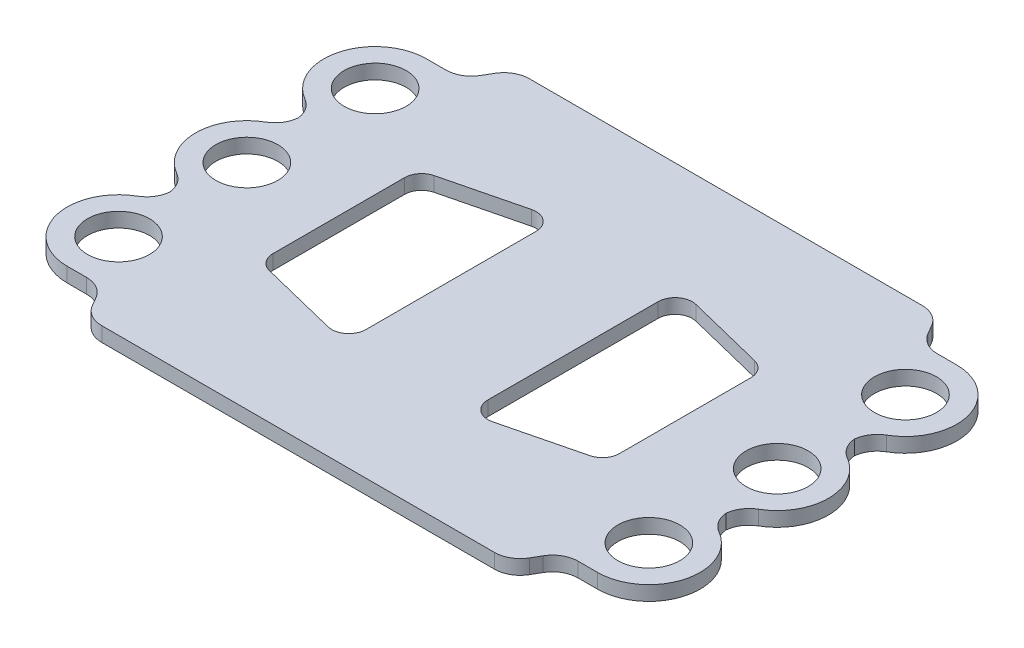
from build123d import *

# Parameters (mm, degrees)
SKETCH1_R           = 6
SKETCH1_R_2         = 3.625
BOSS_EXTRUDE1_DEPTH = 1.7
CUT_EXTRUDE1_REACH  = 46.687
SKETCH2_W           = 13.125
SKETCH2_H           = 18.5
FILLET1_R           = 3
FILLET2_R           = 2


with BuildPart() as part:
    # Sketch1 → Boss-Extrude1 (new body)
    # profile 1 of 7: a face of its own
    with BuildSketch(Plane(origin=(0, 0, 0), x_dir=(1, 0, 0), z_dir=(0, 1, 0))):
        with BuildLine():
            Line((24.690598923, 25), (-24.690598923, 25))
            Line((-24.690598923, 25), (-27, 21))
            Line((-27, 21), (-31, 21))
            ThreePointArc((-31, 21), (-26.757359313, 19.242640687), (-25, 15))
            ThreePointArc((-25, 15), (-27.325765386, 10.25658351), (-32.5, 9.190524981))
            Line((-32.5, 9.190524981), (-32.5, 5.809475019))
            ThreePointArc((-32.5, 5.809475019), (-27.325765386, 4.74341649), (-25, 0))
            ThreePointArc((-25, 0), (-27.325765386, -4.74341649), (-32.5, -5.809475019))
            Line((-32.5, -5.809475019), (-32.5, -9.190524981))
            ThreePointArc((-32.5, -9.190524981), (-27.325765386, -10.25658351), (-25, -15))
            ThreePointArc((-25, -15), (-26.757359313, -19.242640687), (-31, -21))
            Line((-31, -21), (-27, -21))
            Line((-27, -21), (-24.690598923, -25))
            Line((-24.690598923, -25), (24.690598923, -25))
            Line((24.690598923, -25), (27, -21))
            Line((27, -21), (31, -21))
            ThreePointArc((31, -21), (25.047821822, -14.243974245), (32.5, -9.190524981))
            Line((32.5, -9.190524981), (32.5, -5.809475019))
            ThreePointArc((32.5, -5.809475019), (25, 0), (32.5, 5.809475019))
            Line((32.5, 5.809475019), (32.5, 9.190524981))
            ThreePointArc((32.5, 9.190524981), (25.047821822, 14.243974245), (31, 21))
            Line((31, 21), (27, 21))
            Line((27, 21), (24.690598923, 25))
        make_face()
    # profile 2 of 7: a face of its own
    with BuildSketch(Plane(origin=(0, 0, 0), x_dir=(1, 0, 0), z_dir=(0, 1, 0))):
        with Locations((-31, 15)):
            Circle(SKETCH1_R)
        with Locations(Location((-31, 15, 0), (0, 0, 270))):
            Circle(SKETCH1_R_2, mode=Mode.SUBTRACT)
    # profile 3 of 7: a face of its own
    with BuildSketch(Plane(origin=(0, 0, 0), x_dir=(1, 0, 0), z_dir=(0, 1, 0))):
        with Locations((-31, 0)):
            Circle(SKETCH1_R)
        with Locations(Location((-31, 0, 0), (0, 0, 270))):
            Circle(SKETCH1_R_2, mode=Mode.SUBTRACT)
    # profile 4 of 7: a face of its own
    with BuildSketch(Plane(origin=(0, 0, 0), x_dir=(1, 0, 0), z_dir=(0, 1, 0))):
        with Locations((-31, -15)):
            Circle(SKETCH1_R)
        with Locations(Location((-31, -15, 0), (0, 0, 270))):
            Circle(SKETCH1_R_2, mode=Mode.SUBTRACT)
    # profile 5 of 7: a face of its own
    with BuildSketch(Plane(origin=(0, 0, 0), x_dir=(1, 0, 0), z_dir=(0, 1, 0))):
        with Locations((31, -15)):
            Circle(SKETCH1_R)
        with Locations(Location((31, -15, 0), (0, 0, 270))):
            Circle(SKETCH1_R_2, mode=Mode.SUBTRACT)
    # profile 6 of 7: a face of its own
    with BuildSketch(Plane(origin=(0, 0, 0), x_dir=(1, 0, 0), z_dir=(0, 1, 0))):
        with Locations((31, 0)):
            Circle(SKETCH1_R)
        with Locations(Location((31, 0, 0), (0, 0, 270))):
            Circle(SKETCH1_R_2, mode=Mode.SUBTRACT)
    # profile 7 of 7: a face of its own
    with BuildSketch(Plane(origin=(0, 0, 0), x_dir=(1, 0, 0), z_dir=(0, 1, 0))):
        with Locations((31, 15)):
            Circle(SKETCH1_R)
        with Locations(Location((31, 15, 0), (0, 0, 270))):
            Circle(SKETCH1_R_2, mode=Mode.SUBTRACT)
    extrude(amount=BOSS_EXTRUDE1_DEPTH)

    # Sketch2 → Cut-Extrude1 (cut, up to next)
    with BuildSketch(Plane(origin=(0, 1.7, 0), x_dir=(1, 0, 0), z_dir=(0, 1, 0)), mode=Mode.PRIVATE) as cut_extrude1_sk1:
        with Locations((-13.6875, 0)):
            Rectangle(SKETCH2_W, SKETCH2_H)
    cut_extrude1_tool1 = extrude(cut_extrude1_sk1.sketch, amount=-CUT_EXTRUDE1_REACH, mode=Mode.PRIVATE) & part.part
    # Sketch2 → Cut-Extrude1 (cut, up to next)
    with BuildSketch(Plane(origin=(0, 1.7, 0), x_dir=(1, 0, 0), z_dir=(0, 1, 0)), mode=Mode.PRIVATE) as cut_extrude1_sk2:
        Polygon((-7.125, 9.25), (-7.125, 12.5), (-20.25, 9.25), align=None)
    cut_extrude1_tool2 = extrude(cut_extrude1_sk2.sketch, amount=-CUT_EXTRUDE1_REACH, mode=Mode.PRIVATE) & part.part
    # Sketch2 → Cut-Extrude1 (cut, up to next)
    with BuildSketch(Plane(origin=(0, 1.7, 0), x_dir=(1, 0, 0), z_dir=(0, 1, 0)), mode=Mode.PRIVATE) as cut_extrude1_sk3:
        Polygon((-7.125, -12.5), (-7.125, -9.25), (-20.25, -9.25), align=None)
    cut_extrude1_tool3 = extrude(cut_extrude1_sk3.sketch, amount=-CUT_EXTRUDE1_REACH, mode=Mode.PRIVATE) & part.part
    # Sketch2 → Cut-Extrude1 (cut, up to next)
    with BuildSketch(Plane(origin=(0, 1.7, 0), x_dir=(1, 0, 0), z_dir=(0, 1, 0)), mode=Mode.PRIVATE) as cut_extrude1_sk4:
        Polygon((7.125, -12.5), (20.25, -9.25), (7.125, -9.25), align=None)
    cut_extrude1_tool4 = extrude(cut_extrude1_sk4.sketch, amount=-CUT_EXTRUDE1_REACH, mode=Mode.PRIVATE) & part.part
    # Sketch2 → Cut-Extrude1 (cut, up to next)
    with BuildSketch(Plane(origin=(0, 1.7, 0), x_dir=(1, 0, 0), z_dir=(0, 1, 0)), mode=Mode.PRIVATE) as cut_extrude1_sk5:
        with Locations((13.6875, 0)):
            Rectangle(SKETCH2_W, SKETCH2_H)
    cut_extrude1_tool5 = extrude(cut_extrude1_sk5.sketch, amount=-CUT_EXTRUDE1_REACH, mode=Mode.PRIVATE) & part.part
    # Sketch2 → Cut-Extrude1 (cut, up to next)
    with BuildSketch(Plane(origin=(0, 1.7, 0), x_dir=(1, 0, 0), z_dir=(0, 1, 0)), mode=Mode.PRIVATE) as cut_extrude1_sk6:
        Polygon((20.25, 9.25), (7.125, 12.5), (7.125, 9.25), align=None)
    cut_extrude1_tool6 = extrude(cut_extrude1_sk6.sketch, amount=-CUT_EXTRUDE1_REACH, mode=Mode.PRIVATE) & part.part
    add(cut_extrude1_tool1.solids().sort_by_distance((-13.6875, 1.7, 0))[0], mode=Mode.SUBTRACT)
    add(cut_extrude1_tool2.solids().sort_by_distance((-11.5, 1.7, -10.333333))[0], mode=Mode.SUBTRACT)
    add(cut_extrude1_tool3.solids().sort_by_distance((-11.5, 1.7, 10.333333))[0], mode=Mode.SUBTRACT)
    add(cut_extrude1_tool4.solids().sort_by_distance((11.5, 1.7, 10.333333))[0], mode=Mode.SUBTRACT)
    add(cut_extrude1_tool5.solids().sort_by_distance((13.6875, 1.7, 0))[0], mode=Mode.SUBTRACT)
    add(cut_extrude1_tool6.solids().sort_by_distance((11.5, 1.7, -10.333333))[0], mode=Mode.SUBTRACT)

    # Fillet1
    # the kernel refuses this fillet: 3 mm, written as the material it adds along each edge
    with BuildSketch(Plane(origin=(32.5, 0, 9.190524981), x_dir=(0, 0, -1), z_dir=(0, 1, 0)), Plane(origin=(32.5, 0, -5.809475019), x_dir=(0, 0, -1), z_dir=(0, 1, 0))) as fillet1_piece_1:
        with BuildLine():
            CenterArc((1.984753615, -3), FILLET1_R, 90, 60)
            ThreePointArc((-0.613322597, -1.5), (-0.255786259, -0.770801874), (0, 0))
            Line((0, 0), (1.984753615, 0))
        make_face()
    extrude(amount=1.7)
    with BuildSketch(Plane(origin=(32.5, 0, 5.809475019), x_dir=(0.9256147934109572, 0, -0.3784669790335627), z_dir=(0, 1, 0)), Plane(origin=(32.5, 0, -9.190524981), x_dir=(0.9256147934109562, 0, -0.378466979033565), z_dir=(0, 1, 0))) as fillet1_piece_2:
        with BuildLine():
            CenterArc((2.025680676, -2.972518244), FILLET1_R, 97.761243907, 60)
            Line((-0.751163705, -1.837117307), (0, 0))
            ThreePointArc((0, 0), (0.81027227, -0.054963512), (1.62054454, 0))
        make_face()
    extrude(amount=1.7)
    with BuildSketch(Plane(origin=(-32.5, 0, 9.190524981), x_dir=(0, 0, -1), z_dir=(0, 1, 0)), Plane(origin=(-32.5, 0, -5.809475019), x_dir=(0, 0, -1), z_dir=(0, 1, 0))) as fillet1_piece_3:
        with BuildLine():
            CenterArc((1.984753615, 3), FILLET1_R, 210, 60)
            ThreePointArc((-0.613322597, 1.5), (-0.255786259, 0.770801874), (0, 0))
            Line((0, 0), (1.984753615, 0))
        make_face()
    extrude(amount=1.7)
    with BuildSketch(Plane(origin=(-32.5, 0, 5.809475019), x_dir=(-0.9256147934109573, 0, -0.3784669790335622), z_dir=(0, 1, 0)), Plane(origin=(-32.5, 0, -9.190524981), x_dir=(-0.9256147934109568, 0, -0.37846697903356347), z_dir=(0, 1, 0))) as fillet1_piece_4:
        with BuildLine():
            CenterArc((2.025680676, 2.972518244), FILLET1_R, 202.238756093, 60)
            Line((-0.751163705, 1.837117307), (0, 0))
            ThreePointArc((0, 0), (0.81027227, 0.054963512), (1.62054454, 0))
        make_face()
    extrude(amount=1.7)
    with BuildSketch(Plane(origin=(-27, 0, 21), x_dir=(0.49999999999999767, 0, 0.8660254037844399), z_dir=(0, 1, 0)), Plane(origin=(27, 0, 21), x_dir=(1, 0, 0), z_dir=(0, 1, 0))) as fillet1_piece_5:
        with BuildLine():
            CenterArc((FILLET1_R * 0.57735026919, -FILLET1_R), FILLET1_R, 90, 60)
            Line((-FILLET1_R * 0.288675134595, -FILLET1_R * 0.5), (0, 0))
            Line((0, 0), (FILLET1_R * 0.57735026919, 0))
        make_face()
    extrude(amount=1.7)
    with BuildSketch(Plane(origin=(27, 0, -21), x_dir=(1, 0, 0), z_dir=(0, 1, 0)), Plane(origin=(-27, 0, -21), x_dir=(0.49999999999999767, 0, -0.8660254037844399), z_dir=(0, 1, 0))) as fillet1_piece_6:
        with BuildLine():
            CenterArc((FILLET1_R * 0.57735026919, FILLET1_R), FILLET1_R, 210, 60)
            Line((-FILLET1_R * 0.288675134595, FILLET1_R * 0.5), (0, 0))
            Line((0, 0), (FILLET1_R * 0.57735026919, 0))
        make_face()
    extrude(amount=1.7)
    # the kernel refuses this fillet: 3 mm, written as the material it takes off along each edge
    with BuildSketch(Plane(origin=(-24.690598923, -4.330127019, 25), x_dir=(1, 0, 0), z_dir=(0, 1, 0)), Plane(origin=(24.690598923, -4.330127019, 25), x_dir=(0.49999999999999767, 0, -0.8660254037844399), z_dir=(0, 1, 0))) as fillet1_2_piece_1:
        with BuildLine():
            CenterArc((FILLET1_R * 0.57735026919, FILLET1_R), FILLET1_R, 210, 60)
            Line((-FILLET1_R * 0.288675134595, FILLET1_R * 0.5), (0, 0))
            Line((0, 0), (FILLET1_R * 0.57735026919, 0))
        make_face()
    extrude(amount=10.360254038, mode=Mode.SUBTRACT)
    with BuildSketch(Plane(origin=(24.690598923, -4.330127019, -25), x_dir=(0.49999999999999767, 0, 0.8660254037844399), z_dir=(0, 1, 0)), Plane(origin=(-24.690598923, -4.330127019, -25), x_dir=(1, 0, 0), z_dir=(0, 1, 0))) as fillet1_2_piece_2:
        with BuildLine():
            CenterArc((FILLET1_R * 0.57735026919, -FILLET1_R), FILLET1_R, 90, 60)
            Line((-FILLET1_R * 0.288675134595, -FILLET1_R * 0.5), (0, 0))
            Line((0, 0), (FILLET1_R * 0.57735026919, 0))
        make_face()
    extrude(amount=10.360254038, mode=Mode.SUBTRACT)

    # Fillet2
    fillet2_edges = [part.edges().sort_by_distance(p)[0] for p in [
        (-20.25, 0.85, 9.25),
        (-20.25, 0.85, -9.25),
        (-7.125, 0.85, -12.5),
        (-7.125, 0.85, 12.5),
        (20.25, 0.85, 9.25),
        (7.125, 0.85, 12.5),
        (7.125, 0.85, -12.5),
        (20.25, 0.85, -9.25),
    ]]
    fillet(fillet2_edges, radius=FILLET2_R)


solid = part.part
